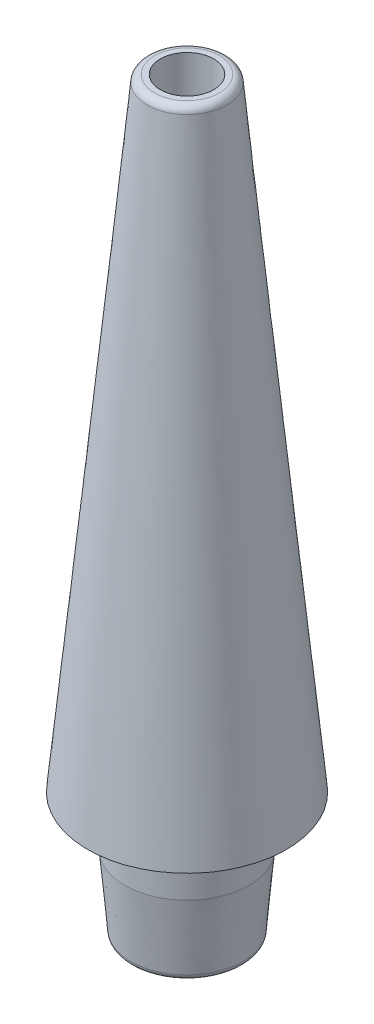
from build123d import *

# Parameters (mm, degrees)
SKETCH1_R           = 2.5
BOSS_EXTRUDE1_DEPTH = 5
SKETCH4_R           = 1.075
CUT_EXTRUDE1_DEPTH  = 31.528675071
CHAMFER1_SIZE       = 0.3
CHAMFER1_SIZE2      = 17.186988489
CHAMFER2_SIZE       = 3
CHAMFER2_SIZE2      = 0.262465991
FILLET1_R           = 0.3
FILLET2_R           = 0.25
FILLET4_R           = 0.25


with BuildPart() as part:
    # Sketch1 → Boss-Extrude1 (new body)
    with BuildSketch(Plane(origin=(0, 0, 0), x_dir=(1, 0, 0), z_dir=(0, 1, 0))):
        with Locations(Location((0, 0, 0), (0, 0, 270))):
            Circle(SKETCH1_R)
    extrude(amount=BOSS_EXTRUDE1_DEPTH)

    # Loft1: read off the stored shape, not the designer's step
    # Loft1: loft between two sections, ruled curve by curve
    loft1_from = [
        Edge.make_bspline([(-1.392393657, 30, -0.736114736), (0.079835815, 30, -3.52090205), (2.864623129, 30, -2.048672577), (1.392393657, 30, 0.736114736), (-0.079835815, 30, 3.52090205), (-2.864623129, 30, 2.048672577), (-1.392393657, 30, -0.736114736)], [0, 0, 0, 0, 0.5, 0.5, 0.5, 1, 1, 1, 1], 3, [1, 0.333333333, 0.333333333, 1, 0.333333333, 0.333333333, 1]),
    ]
    loft1_to = [
        Edge.make_bspline([(-3.843967333, 5, -1.106306985), (-1.631353363, 5, -8.79424165), (6.056581302, 5, -6.581627681), (3.843967333, 5, 1.106306985), (1.631353363, 5, 8.79424165), (-6.056581302, 5, 6.581627681), (-3.843967333, 5, -1.106306985)], [0, 0, 0, 0, 0.5, 0.5, 0.5, 1, 1, 1, 1], 3, [1, 0.333333333, 0.333333333, 1, 0.333333333, 0.333333333, 1]),
    ]
    loft1 = Solid(Shell([*[Face.make_surface_from_curves(loft1_from[k], loft1_to[k]) for k in range(1)], Face(Wire(loft1_from)), Face(Wire(loft1_to))]))
    add(loft1)

    # Sketch4 → Cut-Extrude1 (cut, through all)
    with BuildSketch(Plane(origin=(0, 30, 0), x_dir=(1, 0, 0), z_dir=(0, 1, 0))):
        with Locations(Location((0, 0, 0), (0, 0, 270))):
            Circle(SKETCH4_R)
    extrude(amount=-CUT_EXTRUDE1_DEPTH, mode=Mode.SUBTRACT)

    # Chamfer1
    chamfer1_edges = [part.edges().sort_by_distance(p)[0] for p in [
        (0, 0, -1.075),
    ]]
    chamfer1_side = [part.faces().sort_by_distance(p)[0] for p in [
        (0, 0, -2.429289322),
    ]]
    chamfer(chamfer1_edges, length=CHAMFER1_SIZE, length2=CHAMFER1_SIZE2, reference=chamfer1_side[0])

    # Chamfer2
    chamfer2_edges = [part.edges().sort_by_distance(p)[0] for p in [
        (0, 0, -2.5),
    ]]
    chamfer2_side = [part.faces().sort_by_distance(p)[0] for p in [
        (0, 2.5, -2.5),
    ]]
    chamfer(chamfer2_edges, length=CHAMFER2_SIZE, length2=CHAMFER2_SIZE2, reference=chamfer2_side[0])

    # Fillet1
    fillet1_edges = [part.edges().sort_by_distance(p)[0] for p in [
        (1.392393657, 30, 0.736114736),
    ]]
    fillet(fillet1_edges, radius=FILLET1_R)

    # Fillet2
    fillet2_edges = [part.edges().sort_by_distance(p)[0] for p in [
        (0, 5, -2.5),
    ]]
    fillet(fillet2_edges, radius=FILLET2_R)

    # Fillet4
    fillet4_edges = [part.edges().sort_by_distance(p)[0] for p in [
        (0, 0, -1.375),
        (0, 0, -2.237534009),
    ]]
    fillet(fillet4_edges, radius=FILLET4_R)


solid = part.part
